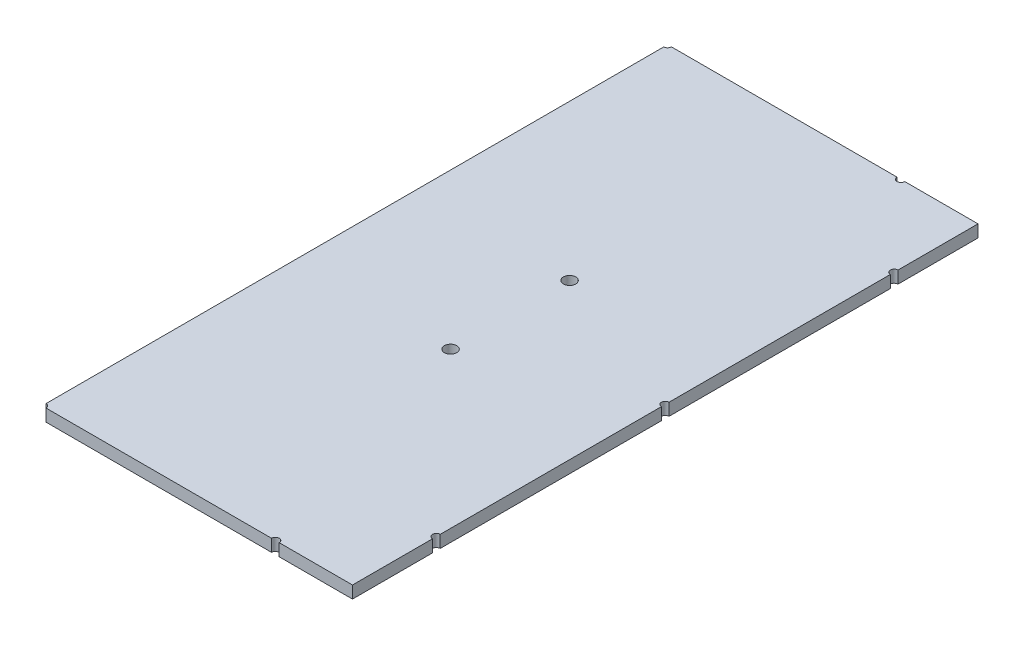
from build123d import *

# Parameters (mm, degrees)
BOSS_EXTRUDE1_DEPTH = 6.35
CUT_EXTRUDE1_REACH  = 183.234
SKETCH2_R           = 3.2


with BuildPart() as part:
    # Sketch1 → Boss-Extrude1 (new body)
    with BuildSketch(Plane(origin=(0, 0, 0), x_dir=(1, 0, 0), z_dir=(0, 1, 0))):
        with BuildLine():
            Line((38.5, 162.25), (-78.5, 162.25))
            ThreePointArc((-78.5, 162.25), (-79.085786438, 160.835786438), (-80.5, 160.25))
            Line((-80.5, 160.25), (-80.5, -160.25))
            ThreePointArc((-80.5, -160.25), (-79.085786438, -160.835786438), (-78.5, -162.25))
            Line((-78.5, -162.25), (38.5, -162.25))
            ThreePointArc((38.5, -162.25), (40.5, -160.25), (42.5, -162.25))
            Line((42.5, -162.25), (80.5, -162.25))
            Line((80.5, -162.25), (80.5, -120.75))
            ThreePointArc((80.5, -120.75), (78.5, -118.75), (80.5, -116.75))
            Line((80.5, -116.75), (80.5, -2))
            ThreePointArc((80.5, -2), (78.5, 0), (80.5, 2))
            Line((80.5, 2), (80.5, 116.75))
            ThreePointArc((80.5, 116.75), (78.5, 118.75), (80.5, 120.75))
            Line((80.5, 120.75), (80.5, 162.25))
            Line((80.5, 162.25), (42.5, 162.25))
            ThreePointArc((42.5, 162.25), (40.5, 160.25), (38.5, 162.25))
        make_face()
    extrude(amount=BOSS_EXTRUDE1_DEPTH)

    # Sketch2 → Cut-Extrude1 (cut, up to next)
    with BuildSketch(Plane(origin=(0, 6.35, 0), x_dir=(1, 0, 0), z_dir=(0, 1, 0)), mode=Mode.PRIVATE) as cut_extrude1_sk1:
        with Locations((0, 30.864677907)):
            Circle(SKETCH2_R)
    cut_extrude1_tool1 = extrude(cut_extrude1_sk1.sketch, amount=-CUT_EXTRUDE1_REACH, mode=Mode.PRIVATE) & part.part
    # Sketch2 → Cut-Extrude1 (cut, up to next)
    with BuildSketch(Plane(origin=(0, 6.35, 0), x_dir=(1, 0, 0), z_dir=(0, 1, 0)), mode=Mode.PRIVATE) as cut_extrude1_sk2:
        with Locations((0, -30.864677907)):
            Circle(SKETCH2_R)
    cut_extrude1_tool2 = extrude(cut_extrude1_sk2.sketch, amount=-CUT_EXTRUDE1_REACH, mode=Mode.PRIVATE) & part.part
    add(cut_extrude1_tool1.solids().sort_by_distance((0, 6.35, -30.864678))[0], mode=Mode.SUBTRACT)
    add(cut_extrude1_tool2.solids().sort_by_distance((0, 6.35, 30.864678))[0], mode=Mode.SUBTRACT)


solid = part.part
